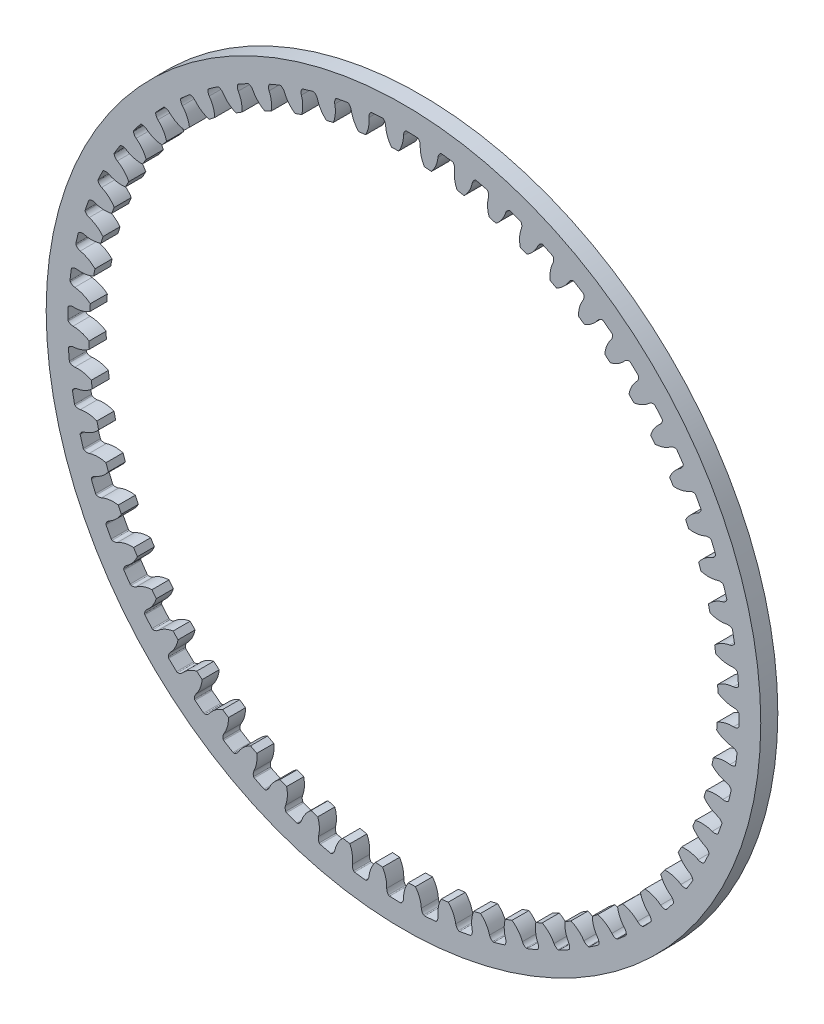
from build123d import *

# Parameters (mm, degrees)
BOSS_EXTRUDE1_DEPTH = 3.5
CHAMFER1_SIZE       = 0.5
FILLET2_R           = 1.4
FILLET3_R           = 0.3
CIRPATTERN1_DEPTH   = 3.5


# Read off the part's stored shape, not the designer's step: CirPattern1
with BuildPart() as part:
    # Sketch1 → Boss-Extrude1 (new body)
    with BuildSketch(Plane.XY):
        with BuildLine():
            Line((-7.093200614, 67.487306793), (-7.203054967, 68.532503961))
            ThreePointArc((-7.203054967, 68.532503961), (-5.465102965, 68.692945414), (-3.7236451, 68.809320351))
            Line((-3.7236451, 68.809320351), (-3.669087823, 67.801148418))
            ThreePointArc((-3.669087823, 67.801148418), (-3.311888955, 66.061957245), (-2.461340021, 64.503450435))
            Line((-2.461340021, 64.503450435), (-0.999634675, 64.542971937))
            ThreePointArc((-0.999634675, 64.542971937), (-0.255341962, 66.127311516), (0, 67.859045914))
            Line((0, 67.859045914), (0, 68.91))
            ThreePointArc((0, 68.91), (0.866615162, 68.90455049), (1.733093257, 68.88820282))
            Line((1.733093257, 68.88820282), (1.844759693, 73.326798387))
            ThreePointArc((1.844759693, 73.326798387), (-5.830083646, 73.117936409), (-13.441051368, 72.107979018))
            Line((-13.441051368, 72.107979018), (-12.627441714, 67.743160657))
            ThreePointArc((-12.627441714, 67.743160657), (-11.762567505, 67.898675287), (-10.895780524, 68.043148566))
            Line((-10.895780524, 68.043148566), (-10.736139102, 67.046202549))
            ThreePointArc((-10.736139102, 67.046202549), (-10.199101212, 65.353876174), (-9.190302449, 63.892813782))
            Line((-9.190302449, 63.892813782), (-7.740736018, 64.084908534))
            ThreePointArc((-7.740736018, 64.084908534), (-7.166128741, 65.738368542), (-7.093200614, 67.487306793))
        make_face()
    extrude(amount=BOSS_EXTRUDE1_DEPTH)

    # Chamfer1
    chamfer1_edges = [part.edges().sort_by_distance(p)[0] for p in [
        (-3.7236451, 68.809320351, 1.75),
        (-7.203054967, 68.532503961, 1.75),
        (-10.895780524, 68.043148566, 1.75),
        (0, 68.91, 1.75),
    ]]
    chamfer(chamfer1_edges, length=CHAMFER1_SIZE - 0.0004)  # a hair under: the kernel refuses the full size

    # Fillet2
    fillet2_edges = [part.edges().sort_by_distance(p)[0] for p in [
        (0, 68.4104, 1.75),
        (-3.696648719, 68.310450272, 1.75),
        (-7.150832686, 68.035640807, 1.75),
        (-10.81678572, 67.54983327, 1.75),
    ]]
    fillet(fillet2_edges, radius=FILLET2_R)

    # Fillet3
    fillet3_edges = [part.edges().sort_by_distance(p)[0] for p in [
        (-11.38880622, 67.962366004, 1.75),
        (0.499596717, 68.908188941, 1.75),
        (-4.222414028, 68.780515553, 1.75),
        (-6.706005784, 68.58292489, 1.75),
    ]]
    fillet(fillet3_edges, radius=FILLET3_R)

    # CirPattern1 outline → CirPattern1 (add)
    with BuildSketch(Plane.XY):
        with BuildLine():
            Line((1.844759693, 73.326798387), (1.733093257, 68.88820282))
            ThreePointArc((1.733093257, 68.88820282), (2.299511856, 68.871622205), (2.86577496, 68.850384413))
            ThreePointArc((2.86577496, 68.850384413), (2.980831386, 68.822186651), (3.076002513, 68.751649061))
            ThreePointArc((3.076002513, 68.751649061), (3.353485369, 68.289151249), (3.435535192, 67.756076407))
            ThreePointArc((3.435535192, 67.756076407), (3.618653485, 66.018512763), (4.294590654, 64.407373827))
            Line((4.294590654, 64.407373827), (5.752419325, 64.29388904))
            ThreePointArc((5.752419325, 64.29388904), (6.65368157, 65.780913241), (7.090699115, 67.463925503))
            ThreePointArc((7.090699115, 67.463925503), (7.25312204, 67.982028039), (7.600452429, 68.399368483))
            ThreePointArc((7.600452429, 68.399368483), (7.705424882, 68.454381137), (7.823510636, 68.464449033))
            ThreePointArc((7.823510636, 68.464449033), (8.936389306, 68.328098511), (10.046902252, 68.17365954))
            ThreePointArc((10.046902252, 68.17365954), (10.158380982, 68.133589535), (10.245657588, 68.05349018))
            ThreePointArc((10.245657588, 68.05349018), (10.4732759, 67.564521093), (10.499154515, 67.025790028))
            ThreePointArc((10.499154515, 67.025790028), (10.499644069, 65.278604195), (11.003467608, 63.605636647))
            Line((11.003467608, 63.605636647), (12.441448167, 63.34038888))
            ThreePointArc((12.441448167, 63.34038888), (13.493209118, 64.725059646), (14.103754874, 66.353171468))
            ThreePointArc((14.103754874, 66.353171468), (14.319444274, 66.851457878), (14.708495626, 67.230206223))
            ThreePointArc((14.708495626, 67.230206223), (14.818643464, 67.273944969), (14.937134782, 67.271614404))
            ThreePointArc((14.937134782, 67.271614404), (16.029664521, 67.019683343), (17.117950738, 66.750010206))
            ThreePointArc((17.117950738, 66.750010206), (17.224630261, 66.698507056), (17.30305608, 66.609723692))
            ThreePointArc((17.30305608, 66.609723692), (17.478316569, 66.099640638), (17.447740914, 65.561155642))
            ThreePointArc((17.447740914, 65.561155642), (17.265597838, 63.823489498), (17.591789537, 62.107022574))
            Line((17.591789537, 62.107022574), (18.994166341, 61.692918078))
            ThreePointArc((18.994166341, 61.692918078), (20.184903559, 62.960064275), (20.962289148, 64.515437624))
            ThreePointArc((20.962289148, 64.515437624), (21.228882316, 64.988448752), (21.65539266, 65.324455258))
            ThreePointArc((21.65539266, 65.324455258), (21.769508987, 65.356440753), (21.887107517, 65.341737232))
            ThreePointArc((21.887107517, 65.341737232), (22.947318251, 64.976985811), (24.001454157, 64.595033078))
            ThreePointArc((24.001454157, 64.595033078), (24.102165787, 64.532660967), (24.170881597, 64.436166149))
            ThreePointArc((24.170881597, 64.436166149), (24.291863513, 63.910557702), (24.205168131, 63.378218736))
            ThreePointArc((24.205168131, 63.378218736), (23.842386627, 61.669111322), (23.987370901, 59.927951325))
            Line((23.987370901, 59.927951325), (25.338780023, 59.369526888))
            ThreePointArc((25.338780023, 59.369526888), (26.655446714, 60.505265877), (27.591154063, 61.97085995))
            ThreePointArc((27.591154063, 61.97085995), (27.905729702, 62.413413258), (28.365025556, 62.702996719))
            ThreePointArc((28.365025556, 62.702996719), (28.481860196, 62.722878645), (28.597277643, 62.695963278))
            ThreePointArc((28.597277643, 62.695963278), (29.613553574, 62.22238781), (30.621989928, 61.732340251))
            ThreePointArc((30.621989928, 61.732340251), (30.71563014, 61.659782649), (30.773883068, 61.556633769))
            ThreePointArc((30.773883068, 61.556633769), (30.839261464, 61.021258549), (30.697396635, 60.500897778))
            ThreePointArc((30.697396635, 60.500897778), (30.157952716, 58.839073484), (30.120142804, 57.092296412))
            Line((30.120142804, 57.092296412), (31.405777144, 56.395670561))
            ThreePointArc((31.405777144, 56.395670561), (32.833948405, 57.387558385), (33.917726556, 58.747315543))
            ThreePointArc((33.917726556, 58.747315543), (34.276838568, 59.154562406), (34.763888318, 59.394549876))
            ThreePointArc((34.763888318, 59.394549876), (34.882161088, 59.402110294), (34.994132774, 59.36327797))
            ThreePointArc((34.994132774, 59.36327797), (35.955339275, 58.786067037), (36.907027344, 58.193293709))
            ThreePointArc((36.907027344, 58.193293709), (36.992570292, 58.111345453), (37.039722096, 58.002672457))
            ThreePointArc((37.039722096, 58.002672457), (37.048780125, 57.463396261), (36.853299751, 56.960715162))
            ThreePointArc((36.853299751, 56.960715162), (36.143102481, 55.364382361), (35.922910982, 53.631126963))
            Line((35.922910982, 53.631126963), (37.128685603, 52.803931684))
            ThreePointArc((37.128685603, 52.803931684), (38.652713382, 53.641101654), (39.872687422, 54.880124483))
            ThreePointArc((39.872687422, 54.880124483), (40.272400835, 55.247602986), (40.78186776, 55.435365376))
            ThreePointArc((40.78186776, 55.435365376), (40.900282967, 55.430521547), (41.007582247, 55.380197709))
            ThreePointArc((41.007582247, 55.380197709), (41.903188234, 54.705675353), (42.787701218, 54.016670802))
            ThreePointArc((42.787701218, 54.016670802), (42.864209593, 53.926229863), (42.899743696, 53.813223569))
            ThreePointArc((42.899743696, 53.813223569), (42.85238265, 53.275954649), (42.60542882, 52.796460366))
            ThreePointArc((42.60542882, 52.796460366), (41.732260347, 51.283107617), (41.332101297, 49.582362938))
            Line((41.332101297, 49.582362938), (42.444804783, 48.633661623))
            ThreePointArc((42.444804783, 48.633661623), (44.047992151, 49.306940817), (45.390796558, 50.411653871))
            ThreePointArc((45.390796558, 50.411653871), (45.826732496, 50.735337827), (46.353035241, 50.868817659))
            ThreePointArc((46.353035241, 50.868817659), (46.470295365, 50.851622571), (46.571746508, 50.790358605))
            ThreePointArc((46.571746508, 50.790358605), (47.391939439, 50.025915046), (48.199586335, 49.248228162))
            ThreePointArc((48.199586335, 49.248228162), (48.266221965, 49.150285293), (48.289749003, 49.034183652))
            ThreePointArc((48.289749003, 49.034183652), (48.186487266, 48.504808664), (47.890765331, 48.053755008))
            ThreePointArc((47.890765331, 48.053755008), (46.864191322, 46.639964225), (46.288447476, 44.990365002))
            Line((46.288447476, 44.990365002), (47.29588946, 43.930551285))
            ThreePointArc((47.29588946, 43.930551285), (48.960670999, 44.432563889), (50.41159301, 45.390864231))
            ThreePointArc((50.41159301, 45.390864231), (50.878974803, 45.667207356), (51.416346649, 45.744942558))
            ThreePointArc((51.416346649, 45.744942558), (51.531167112, 45.715584672), (51.62565873, 45.644051756))
            ThreePointArc((51.62565873, 45.644051756), (52.361452494, 44.798062377), (53.083384646, 43.940213638))
            ThreePointArc((53.083384646, 43.940213638), (53.139417401, 43.835842065), (53.150679669, 43.717917274))
            ThreePointArc((53.150679669, 43.717917274), (52.992649086, 43.202235884), (52.651399323, 42.78456429))
            ThreePointArc((52.651399323, 42.78456429), (51.482667946, 41.485823863), (50.73764863, 39.905442281))
            Line((50.73764863, 39.905442281), (51.628790781, 38.746128303))
            ThreePointArc((51.628790781, 38.746128303), (53.336927274, 39.071373335), (54.880070942, 39.872761023))
            ThreePointArc((54.880070942, 39.872761023), (55.373778312, 40.098735531), (55.916332097, 40.119874014))
            ThreePointArc((55.916332097, 40.119874014), (56.027454747, 40.078674929), (56.113951443, 39.997656849))
            ThreePointArc((56.113951443, 39.997656849), (56.757284438, 39.079390517), (57.385592117, 38.150778725))
            ThreePointArc((57.385592117, 38.150778725), (57.430408131, 38.041121817), (57.429282158, 37.922665729))
            ThreePointArc((57.429282158, 37.922665729), (57.21821369, 37.426328177), (56.835174659, 37.046615173))
            ThreePointArc((56.835174659, 37.046615173), (55.537090124, 35.877155848), (54.630956698, 34.383308203))
            Line((54.630956698, 34.383308203), (55.396035996, 33.137194992))
            ThreePointArc((55.396035996, 33.137194992), (57.128812354, 33.282109872), (58.747270082, 33.917805404))
            ThreePointArc((58.747270082, 33.917805404), (59.261893428, 34.090935629), (59.803684467, 34.055246241))
            ThreePointArc((59.803684467, 34.055246241), (59.909891979, 34.002657379), (59.987446199, 33.913041717))
            ThreePointArc((59.987446199, 33.913041717), (60.531270022, 32.932559111), (61.059069442, 31.94335829))
            ThreePointArc((61.059069442, 31.94335829), (61.092177677, 31.829617621), (61.078675895, 31.711928212))
            ThreePointArc((61.078675895, 31.711928212), (60.81688247, 31.240372104), (60.396251025, 30.902777452))
            ThreePointArc((60.396251025, 30.902777452), (58.983035915, 29.875410536), (57.925717252, 28.484462308))
            Line((57.925717252, 28.484462308), (58.556350879, 27.165203251))
            ThreePointArc((58.556350879, 27.165203251), (60.294782736, 27.128199352), (61.970822882, 27.591237187))
            ThreePointArc((61.970822882, 27.591237187), (62.500724303, 27.709626076), (63.035816924, 27.617499358))
            ThreePointArc((63.035816924, 27.617499358), (63.135945506, 27.554096874), (63.203707436, 27.456865559))
            ThreePointArc((63.203707436, 27.456865559), (63.642063756, 26.424909099), (64.063572157, 25.385957191))
            ThreePointArc((64.063572157, 25.385957191), (64.08460988, 25.269378776), (64.058880107, 25.15374534))
            ThreePointArc((64.058880107, 25.15374534), (63.749229611, 24.712137557), (63.29561413, 24.420360486))
            ThreePointArc((63.29561413, 24.420360486), (61.782751591, 23.546343603), (60.585830964, 22.273535846))
            Line((60.585830964, 22.273535846), (61.075109939, 20.895584268))
            ThreePointArc((61.075109939, 20.895584268), (62.800150473, 20.677067948), (64.51540955, 20.962375724))
            ThreePointArc((64.51540955, 20.962375724), (65.054782939, 21.024726429), (65.577314304, 20.877172249))
            ThreePointArc((65.577314304, 20.877172249), (65.670267088, 20.803650796), (65.727494418, 20.699869021))
            ThreePointArc((65.727494418, 20.699869021), (66.055580589, 19.627744982), (66.366179911, 18.550424903))
            ThreePointArc((66.366179911, 18.550424903), (66.374916636, 18.432286151), (66.337240896, 18.319975717))
            ThreePointArc((66.337240896, 18.319975717), (65.983126258, 17.913154155), (65.501496745, 17.670390951))
            ThreePointArc((65.501496745, 17.670390951), (63.905562183, 16.95929841), (62.582154071, 15.818574649))
            Line((62.582154071, 15.818574649), (62.92471746, 14.397028464))
            ThreePointArc((62.92471746, 14.397028464), (64.617466866, 13.999392883), (66.353152493, 14.103843889))
            ThreePointArc((66.353152493, 14.103843889), (66.896088731, 14.109472996), (67.400334072, 13.908107456))
            ThreePointArc((67.400334072, 13.908107456), (67.485092487, 13.825272566), (67.531158129, 13.716077491))
            ThreePointArc((67.531158129, 13.716077491), (67.745379499, 12.615532352), (67.941666682, 11.511647511))
            ThreePointArc((67.941666682, 11.511647511), (67.938006665, 11.393242626), (67.888797606, 11.285485579))
            ThreePointArc((67.888797606, 11.285485579), (67.494098296, 10.917907943), (66.989731537, 10.726818863))
            ThreePointArc((66.989731537, 10.726818863), (65.328210346, 10.186443155), (63.892813694, 9.190303092))
            Line((63.892813694, 9.190303092), (64.084908507, 7.740736243))
            ThreePointArc((64.084908507, 7.740736243), (65.726820669, 7.168338935), (67.463916042, 7.090789637))
            ThreePointArc((67.463916042, 7.090789637), (68.004466269, 7.039635796), (68.484900831, 6.786665649))
            ThreePointArc((68.484900831, 6.786665649), (68.560536403, 6.695424846), (68.594935735, 6.582012721))
            ThreePointArc((68.594935735, 6.582012721), (68.692945314, 5.465104214), (68.772769856, 4.346748933))
            ThreePointArc((68.772769856, 4.346748933), (68.756753236, 4.229375329), (68.696550149, 4.127352374))
            ThreePointArc((68.696550149, 4.127352374), (68.265590806, 3.803045412), (67.744012745, 3.665723573))
            ThreePointArc((67.744012745, 3.665723573), (66.03510873, 3.301983564), (64.503450455, 2.461339372))
            Line((64.503450455, 2.461339372), (64.542971941, 0.999634448))
            ThreePointArc((64.542971941, 0.999634448), (66.116057625, 0.258745767), (67.835530942, 4.4935e-05))
            ThreePointArc((67.835530942, 4.4935e-05), (68.367773077, -0.107331758), (68.819133198, -0.40913548))
            ThreePointArc((68.819133198, -0.40913548), (68.884817096, -0.507782494), (68.907173161, -0.62416898))
            ThreePointArc((68.907173161, -0.62416898), (68.88789708, -1.745203695), (68.850384353, -2.865776403))
            ThreePointArc((68.850384353, -2.865776403), (68.822186556, -2.980832897), (68.751648884, -3.076004056))
            ThreePointArc((68.751648884, -3.076004056), (68.289151013, -3.353486637), (67.756076224, -3.435536217))
            ThreePointArc((67.756076224, -3.435536217), (66.01851283, -3.618653739), (64.407373874, -4.294590007))
            Line((64.407373874, -4.294590007), (64.29388906, -5.752419099))
            ThreePointArc((64.29388906, -5.752419099), (65.78091341, -6.653680887), (67.463925676, -7.090697983))
            ThreePointArc((67.463925676, -7.090697983), (67.982028102, -7.253120701), (68.399368564, -7.600450806))
            ThreePointArc((68.399368564, -7.600450806), (68.454381288, -7.705423298), (68.464449206, -7.823509119))
            ThreePointArc((68.464449206, -7.823509119), (68.328098704, -8.936387833), (68.173659751, -10.046900823))
            ThreePointArc((68.173659751, -10.046900823), (68.133589788, -10.158379489), (68.053490518, -10.245656072))
            ThreePointArc((68.053490518, -10.245656072), (67.564521462, -10.473274664), (67.025790317, -10.499153514))
            ThreePointArc((67.025790317, -10.499153514), (65.278604154, -10.499643809), (63.605636532, -11.003468246))
            Line((63.605636532, -11.003468246), (63.340388836, -12.441448389))
            ThreePointArc((63.340388836, -12.441448389), (64.725059405, -13.49320978), (66.353171178, -14.103755982))
            ThreePointArc((66.353171178, -14.103755982), (66.851457676, -14.3194456), (67.230205973, -14.708497232))
            ThreePointArc((67.230205973, -14.708497232), (67.273944653, -14.818645022), (67.271614073, -14.937136272))
            ThreePointArc((67.271614073, -14.937136272), (67.019682997, -16.029665966), (66.750009847, -17.117952137))
            ThreePointArc((66.750009847, -17.117952137), (66.69850665, -17.22463172), (66.609723198, -17.303057553))
            ThreePointArc((66.609723198, -17.303057553), (66.099640142, -17.47831776), (65.56115525, -17.447741879))
            ThreePointArc((65.56115525, -17.447741879), (63.823489512, -17.265598101), (62.107022755, -17.591788915))
            Line((62.107022755, -17.591788915), (61.692918145, -18.994166124))
            ThreePointArc((61.692918145, -18.994166124), (62.960064583, -20.184902926), (64.515438029, -20.962288076))
            ThreePointArc((64.515438029, -20.962288076), (64.988449092, -21.22888102), (65.324455675, -21.655391089))
            ThreePointArc((65.324455675, -21.655391089), (65.356441231, -21.769507469), (65.341737717, -21.887106069))
            ThreePointArc((65.341737717, -21.887106069), (64.976986306, -22.94731685), (64.595033581, -24.001452803))
            ThreePointArc((64.595033581, -24.001452803), (64.532661524, -24.102164379), (64.436166794, -24.170880185))
            ThreePointArc((64.436166794, -24.170880185), (63.910558319, -24.29186238), (63.378219227, -24.205167213))
            ThreePointArc((63.378219227, -24.205167213), (61.669111336, -23.842386364), (59.927951079, -23.987371501))
            Line((59.927951079, -23.987371501), (59.369526799, -25.338780232))
            ThreePointArc((59.369526799, -25.338780232), (60.505265506, -26.655447312), (61.970859436, -27.591155086))
            ThreePointArc((61.970859436, -27.591155086), (62.413412785, -27.905730956), (62.702996141, -28.365027075))
            ThreePointArc((62.702996141, -28.365027075), (62.722878012, -28.481861655), (62.695962645, -28.597279032))
            ThreePointArc((62.695962645, -28.597279032), (62.222387171, -29.613554915), (61.732339609, -30.621991222))
            ThreePointArc((61.732339609, -30.621991222), (61.659781947, -30.715631482), (61.556632979, -30.773884405))
            ThreePointArc((61.556632979, -30.773884405), (61.021257816, -30.839262526), (60.500897194, -30.697397497))
            ThreePointArc((60.500897194, -30.697397497), (58.839073442, -30.157952975), (57.092296719, -30.120142232))
            Line((57.092296719, -30.120142232), (56.395670671, -31.405776945))
            ThreePointArc((56.395670671, -31.405776945), (57.387558817, -32.83394785), (58.747316161, -33.917725592))
            ThreePointArc((58.747316161, -33.917725592), (59.154563008, -34.27683737), (59.394550611, -34.763886868))
            ThreePointArc((59.394550611, -34.763886868), (59.402111076, -34.882159703), (59.363278746, -34.994131459))
            ThreePointArc((59.363278746, -34.994131459), (58.786067812, -35.955338007), (58.193294482, -36.907026124))
            ThreePointArc((58.193294482, -36.907026124), (58.11134629, -36.99256903), (58.002673382, -37.039720848))
            ThreePointArc((58.002673382, -37.039720848), (57.4633971, -37.048779146), (56.960715834, -36.853298955))
            ThreePointArc((56.960715834, -36.853298955), (55.36438243, -36.143102227), (53.631126598, -35.922911518))
            Line((53.631126598, -35.922911518), (52.803931554, -37.128685789))
            ThreePointArc((52.803931554, -37.128685789), (53.641101166, -38.652713889), (54.880123767, -39.872688316))
            ThreePointArc((54.880123767, -39.872688316), (55.247602263, -40.272401964), (55.435364495, -40.781869126))
            ThreePointArc((55.435364495, -40.781869126), (55.430520624, -40.900284263), (55.3801968, -41.007583474))
            ThreePointArc((55.3801968, -41.007583474), (54.70567445, -41.903189413), (54.016669905, -42.78770235))
            ThreePointArc((54.016669905, -42.78770235), (53.926228897, -42.86421076), (53.813222518, -42.89974484))
            ThreePointArc((53.813222518, -42.89974484), (53.275953711, -42.852383537), (52.796459615, -42.605429542))
            ThreePointArc((52.796459615, -42.605429542), (51.283107522, -41.732260592), (49.582363357, -41.332100802))
            Line((49.582363357, -41.332100802), (48.633661772, -42.444804612))
            ThreePointArc((48.633661772, -42.444804612), (49.306941355, -44.047991698), (50.411654676, -45.390795744))
            ThreePointArc((50.411654676, -45.390795744), (50.735338665, -45.826731449), (50.868818678, -46.353033975))
            ThreePointArc((50.868818678, -46.353033975), (50.851623624, -46.470294173), (50.790359637, -46.571745383))
            ThreePointArc((50.790359637, -46.571745383), (50.025916068, -47.391938361), (49.248229172, -48.199585303))
            ThreePointArc((49.248229172, -48.199585303), (49.150286375, -48.266220905), (49.034184816, -48.289747975))
            ThreePointArc((49.034184816, -48.289747975), (48.504809689, -48.186486483), (48.053755831, -47.890764691))
            ThreePointArc((48.053755831, -47.890764691), (46.639964345, -46.864191089), (44.990364534, -46.288447924))
            Line((44.990364534, -46.288447924), (43.930551119, -47.295889614))
            ThreePointArc((43.930551119, -47.295889614), (44.432563307, -48.960671393), (45.390863345, -50.411593735))
            ThreePointArc((45.390863345, -50.411593735), (45.667206414, -50.878975756), (45.744941412, -51.416347802))
            ThreePointArc((45.744941412, -51.416347802), (45.7155835, -51.531168187), (45.644050612, -51.625659741))
            ThreePointArc((45.644050612, -51.625659741), (44.798061248, -52.36145346), (43.940212525, -53.083385567))
            ThreePointArc((43.940212525, -53.083385567), (43.835840878, -53.139418341), (43.717916009, -53.15068057))
            ThreePointArc((43.717916009, -53.15068057), (43.202234783, -52.992649758), (42.784563406, -52.651399872))
            ThreePointArc((42.784563406, -52.651399872), (41.48582372, -51.482668166), (39.905442793, -50.737648233))
            Line((39.905442793, -50.737648233), (38.746128484, -51.628790645))
            ThreePointArc((38.746128484, -51.628790645), (39.071373955, -53.336926943), (39.87276198, -54.880070313))
            ThreePointArc((39.87276198, -54.880070313), (40.098736567, -55.373777462), (40.119875274, -55.916331071))
            ThreePointArc((40.119875274, -55.916331071), (40.078676207, -56.0274538), (39.997658092, -56.113950557))
            ThreePointArc((39.997658092, -56.113950557), (39.079391741, -56.757283596), (38.150779928, -57.385591318))
            ThreePointArc((38.150779928, -57.385591318), (38.041123095, -57.430407319), (37.922667081, -57.429281394))
            ThreePointArc((37.922667081, -57.429281394), (37.426329342, -57.218213136), (37.046616111, -56.835174205))
            ThreePointArc((37.046616111, -56.835174205), (35.877156014, -55.53708992), (34.383307651, -54.63095704))
            Line((34.383307651, -54.63095704), (33.137194797, -55.396036112))
            ThreePointArc((33.137194797, -55.396036112), (33.28210922, -57.128812618), (33.917804386, -58.747270607))
            ThreePointArc((33.917804386, -58.747270607), (34.09093451, -59.261894164), (34.05524488, -59.803685356))
            ThreePointArc((34.05524488, -59.803685356), (34.002656009, -59.909892788), (33.913040387, -59.987446951))
            ThreePointArc((33.913040387, -59.987446951), (32.932557805, -60.531270732), (31.94335701, -61.059070112))
            ThreePointArc((31.94335701, -61.059070112), (31.829616265, -61.09217835), (31.711926788, -61.078676513))
            ThreePointArc((31.711926788, -61.078676513), (31.240370887, -60.816882898), (30.902776472, -60.396251379))
            ThreePointArc((30.902776472, -60.396251379), (29.875410349, -58.9830361), (28.484462892, -57.92571697))
            Line((28.484462892, -57.92571697), (27.165203457, -58.556350784))
            ThreePointArc((27.165203457, -58.556350784), (27.128200028, -60.294782541), (27.591238254, -61.970822466))
            ThreePointArc((27.591238254, -61.970822466), (27.709627267, -62.500723687), (27.617500804, -63.035816182))
            ThreePointArc((27.617500804, -63.035816182), (27.554098321, -63.135944845), (27.456866959, -63.203706828))
            ThreePointArc((27.456866959, -63.203706828), (26.42491047, -63.642063186), (25.385958533, -64.063571625))
            ThreePointArc((25.385958533, -64.063571625), (25.269380195, -64.084609352), (25.153746822, -64.058879641))
            ThreePointArc((25.153746822, -64.058879641), (24.712138811, -63.749229312), (24.420361497, -63.295613881))
            ThreePointArc((24.420361497, -63.295613881), (23.546343808, -61.782751426), (22.273535235, -60.585831184))
            Line((22.273535235, -60.585831184), (20.895584053, -61.075110013))
            ThreePointArc((20.895584053, -61.075110013), (20.677067255, -62.800150597), (20.96237462, -64.515409853))
            ThreePointArc((20.96237462, -64.515409853), (21.02472518, -65.054783427), (20.877170733, -65.57731489))
            ThreePointArc((20.877170733, -65.57731489), (20.803649288, -65.670267593), (20.699867565, -65.727494877))
            ThreePointArc((20.699867565, -65.727494877), (19.627743558, -66.055581012), (18.550423512, -66.366180299))
            ThreePointArc((18.550423512, -66.366180299), (18.432284685, -66.374917013), (18.319974195, -66.337241205))
            ThreePointArc((18.319974195, -66.337241205), (17.913152876, -65.983126424), (17.670389919, -65.501496887))
            ThreePointArc((17.670389919, -65.501496887), (16.959298189, -63.905562326), (15.818575279, -62.582153917))
            Line((15.818575279, -62.582153917), (14.397028685, -62.924717409))
            ThreePointArc((14.397028685, -62.924717409), (13.999393584, -64.617466816), (14.103845019, -66.353152307))
            ThreePointArc((14.103845019, -66.353152307), (14.109474289, -66.896088376), (13.908109025, -67.400333647))
            ThreePointArc((13.908109025, -67.400333647), (13.825274119, -67.485092141), (13.716078987, -67.531157825))
            ThreePointArc((13.716078987, -67.531157825), (12.615533812, -67.745379227), (11.511648935, -67.941666441))
            ThreePointArc((11.511648935, -67.941666441), (11.393244124, -67.938006444), (11.285487125, -67.888797459))
            ThreePointArc((11.285487125, -67.888797459), (10.917909233, -67.494098264), (10.726819904, -66.989731503))
            ThreePointArc((10.726819904, -66.989731503), (10.186443389, -65.328210227), (9.190302449, -63.892813782))
            Line((9.190302449, -63.892813782), (7.740736018, -64.084908534))
            ThreePointArc((7.740736018, -64.084908534), (7.168338232, -65.726820646), (7.090788493, -67.463916109))
            ThreePointArc((7.090788493, -67.463916109), (7.039634473, -68.004466487), (6.786664044, -68.484901089))
            ThreePointArc((6.786664044, -68.484901089), (6.695423265, -68.560536585), (6.582011201, -68.594935881))
            ThreePointArc((6.582011201, -68.594935881), (5.465102733, -68.692945432), (4.346747492, -68.772769947))
            ThreePointArc((4.346747492, -68.772769947), (4.229373817, -68.756753299), (4.127350821, -68.696550134))
            ThreePointArc((4.127350821, -68.696550134), (3.803044127, -68.265590702), (3.665722535, -67.74401267))
            ThreePointArc((3.665722535, -67.74401267), (3.301983318, -66.035108824), (2.461340021, -64.503450435))
            Line((2.461340021, -64.503450435), (0.999634675, -64.542971937))
            ThreePointArc((0.999634675, -64.542971937), (0.258746464, -66.116057722), (4.6079e-05, -67.835530996))
            ThreePointArc((4.6079e-05, -67.835530996), (-0.10733042, -68.367773), (-0.409133857, -68.819133109))
            ThreePointArc((-0.409133857, -68.819133109), (-0.507780904, -68.884817081), (-0.624167454, -68.907173175))
            ThreePointArc((-0.624167454, -68.907173175), (-1.74520221, -68.887897117), (-2.86577496, -68.850384413))
            ThreePointArc((-2.86577496, -68.850384413), (-2.980831386, -68.822186651), (-3.076002513, -68.751649061))
            ThreePointArc((-3.076002513, -68.751649061), (-3.353485369, -68.289151249), (-3.435535192, -67.756076407))
            ThreePointArc((-3.435535192, -67.756076407), (-3.618653485, -66.018512763), (-4.294590654, -64.407373827))
            Line((-4.294590654, -64.407373827), (-5.752419325, -64.29388904))
            ThreePointArc((-5.752419325, -64.29388904), (-6.65368157, -65.780913241), (-7.090699115, -67.463925503))
            ThreePointArc((-7.090699115, -67.463925503), (-7.25312204, -67.982028039), (-7.600452429, -68.399368483))
            ThreePointArc((-7.600452429, -68.399368483), (-7.705424882, -68.454381137), (-7.823510636, -68.464449033))
            ThreePointArc((-7.823510636, -68.464449033), (-8.936389306, -68.328098511), (-10.046902252, -68.17365954))
            ThreePointArc((-10.046902252, -68.17365954), (-10.158380982, -68.133589535), (-10.245657588, -68.05349018))
            ThreePointArc((-10.245657588, -68.05349018), (-10.4732759, -67.564521093), (-10.499154515, -67.025790028))
            ThreePointArc((-10.499154515, -67.025790028), (-10.499644069, -65.278604195), (-11.003467608, -63.605636647))
            Line((-11.003467608, -63.605636647), (-12.441448167, -63.34038888))
            ThreePointArc((-12.441448167, -63.34038888), (-13.493209118, -64.725059646), (-14.103754874, -66.353171468))
            ThreePointArc((-14.103754874, -66.353171468), (-14.319444274, -66.851457878), (-14.708495626, -67.230206223))
            ThreePointArc((-14.708495626, -67.230206223), (-14.818643464, -67.273944969), (-14.937134782, -67.271614404))
            ThreePointArc((-14.937134782, -67.271614404), (-16.029664521, -67.019683343), (-17.117950738, -66.750010206))
            ThreePointArc((-17.117950738, -66.750010206), (-17.224630261, -66.698507056), (-17.30305608, -66.609723692))
            ThreePointArc((-17.30305608, -66.609723692), (-17.478316569, -66.099640638), (-17.447740914, -65.561155642))
            ThreePointArc((-17.447740914, -65.561155642), (-17.265597838, -63.823489498), (-17.591789537, -62.107022574))
            Line((-17.591789537, -62.107022574), (-18.994166341, -61.692918078))
            ThreePointArc((-18.994166341, -61.692918078), (-20.184903559, -62.960064275), (-20.962289148, -64.515437624))
            ThreePointArc((-20.962289148, -64.515437624), (-21.228882316, -64.988448752), (-21.65539266, -65.324455258))
            ThreePointArc((-21.65539266, -65.324455258), (-21.769508987, -65.356440753), (-21.887107517, -65.341737232))
            ThreePointArc((-21.887107517, -65.341737232), (-22.947318251, -64.976985811), (-24.001454157, -64.595033078))
            ThreePointArc((-24.001454157, -64.595033078), (-24.102165787, -64.532660967), (-24.170881597, -64.436166149))
            ThreePointArc((-24.170881597, -64.436166149), (-24.291863513, -63.910557702), (-24.205168131, -63.378218736))
            ThreePointArc((-24.205168131, -63.378218736), (-23.842386627, -61.669111322), (-23.987370901, -59.927951325))
            Line((-23.987370901, -59.927951325), (-25.338780023, -59.369526888))
            ThreePointArc((-25.338780023, -59.369526888), (-26.655446714, -60.505265877), (-27.591154063, -61.97085995))
            ThreePointArc((-27.591154063, -61.97085995), (-27.905729702, -62.413413258), (-28.365025556, -62.702996719))
            ThreePointArc((-28.365025556, -62.702996719), (-28.481860196, -62.722878645), (-28.597277643, -62.695963278))
            ThreePointArc((-28.597277643, -62.695963278), (-29.613553574, -62.22238781), (-30.621989928, -61.732340251))
            ThreePointArc((-30.621989928, -61.732340251), (-30.71563014, -61.659782649), (-30.773883068, -61.556633769))
            ThreePointArc((-30.773883068, -61.556633769), (-30.839261464, -61.021258549), (-30.697396635, -60.500897778))
            ThreePointArc((-30.697396635, -60.500897778), (-30.157952716, -58.839073484), (-30.120142804, -57.092296412))
            Line((-30.120142804, -57.092296412), (-31.405777144, -56.395670561))
            ThreePointArc((-31.405777144, -56.395670561), (-32.833948405, -57.387558385), (-33.917726556, -58.747315543))
            ThreePointArc((-33.917726556, -58.747315543), (-34.276838568, -59.154562406), (-34.763888318, -59.394549876))
            ThreePointArc((-34.763888318, -59.394549876), (-34.882161088, -59.402110294), (-34.994132774, -59.36327797))
            ThreePointArc((-34.994132774, -59.36327797), (-35.955339275, -58.786067037), (-36.907027344, -58.193293709))
            ThreePointArc((-36.907027344, -58.193293709), (-36.992570292, -58.111345453), (-37.039722096, -58.002672457))
            ThreePointArc((-37.039722096, -58.002672457), (-37.048780125, -57.463396261), (-36.853299751, -56.960715162))
            ThreePointArc((-36.853299751, -56.960715162), (-36.143102481, -55.364382361), (-35.922910982, -53.631126963))
            Line((-35.922910982, -53.631126963), (-37.128685603, -52.803931684))
            ThreePointArc((-37.128685603, -52.803931684), (-38.652713382, -53.641101654), (-39.872687422, -54.880124483))
            ThreePointArc((-39.872687422, -54.880124483), (-40.272400835, -55.247602986), (-40.78186776, -55.435365376))
            ThreePointArc((-40.78186776, -55.435365376), (-40.900282967, -55.430521547), (-41.007582247, -55.380197709))
            ThreePointArc((-41.007582247, -55.380197709), (-41.903188234, -54.705675353), (-42.787701218, -54.016670802))
            ThreePointArc((-42.787701218, -54.016670802), (-42.864209593, -53.926229863), (-42.899743696, -53.813223569))
            ThreePointArc((-42.899743696, -53.813223569), (-42.85238265, -53.275954649), (-42.60542882, -52.796460366))
            ThreePointArc((-42.60542882, -52.796460366), (-41.732260347, -51.283107617), (-41.332101297, -49.582362938))
            Line((-41.332101297, -49.582362938), (-42.444804783, -48.633661623))
            ThreePointArc((-42.444804783, -48.633661623), (-44.047992151, -49.306940817), (-45.390796558, -50.411653871))
            ThreePointArc((-45.390796558, -50.411653871), (-45.826732496, -50.735337827), (-46.353035241, -50.868817659))
            ThreePointArc((-46.353035241, -50.868817659), (-46.470295365, -50.851622571), (-46.571746508, -50.790358605))
            ThreePointArc((-46.571746508, -50.790358605), (-47.391939439, -50.025915046), (-48.199586335, -49.248228162))
            ThreePointArc((-48.199586335, -49.248228162), (-48.266221965, -49.150285293), (-48.289749003, -49.034183652))
            ThreePointArc((-48.289749003, -49.034183652), (-48.186487266, -48.504808664), (-47.890765331, -48.053755008))
            ThreePointArc((-47.890765331, -48.053755008), (-46.864191322, -46.639964225), (-46.288447476, -44.990365002))
            Line((-46.288447476, -44.990365002), (-47.29588946, -43.930551285))
            ThreePointArc((-47.29588946, -43.930551285), (-48.960670999, -44.432563889), (-50.41159301, -45.390864231))
            ThreePointArc((-50.41159301, -45.390864231), (-50.878974803, -45.667207356), (-51.416346649, -45.744942558))
            ThreePointArc((-51.416346649, -45.744942558), (-51.531167112, -45.715584672), (-51.62565873, -45.644051756))
            ThreePointArc((-51.62565873, -45.644051756), (-52.361452494, -44.798062377), (-53.083384646, -43.940213638))
            ThreePointArc((-53.083384646, -43.940213638), (-53.139417401, -43.835842065), (-53.150679669, -43.717917274))
            ThreePointArc((-53.150679669, -43.717917274), (-52.992649086, -43.202235884), (-52.651399323, -42.78456429))
            ThreePointArc((-52.651399323, -42.78456429), (-51.482667946, -41.485823863), (-50.73764863, -39.905442281))
            Line((-50.73764863, -39.905442281), (-51.628790781, -38.746128303))
            ThreePointArc((-51.628790781, -38.746128303), (-53.336927274, -39.071373335), (-54.880070942, -39.872761023))
            ThreePointArc((-54.880070942, -39.872761023), (-55.373778312, -40.098735531), (-55.916332097, -40.119874014))
            ThreePointArc((-55.916332097, -40.119874014), (-56.027454747, -40.078674929), (-56.113951443, -39.997656849))
            ThreePointArc((-56.113951443, -39.997656849), (-56.757284438, -39.079390517), (-57.385592117, -38.150778725))
            ThreePointArc((-57.385592117, -38.150778725), (-57.430408131, -38.041121817), (-57.429282158, -37.922665729))
            ThreePointArc((-57.429282158, -37.922665729), (-57.21821369, -37.426328177), (-56.835174659, -37.046615173))
            ThreePointArc((-56.835174659, -37.046615173), (-55.537090124, -35.877155848), (-54.630956698, -34.383308203))
            Line((-54.630956698, -34.383308203), (-55.396035996, -33.137194992))
            ThreePointArc((-55.396035996, -33.137194992), (-57.128812354, -33.282109872), (-58.747270082, -33.917805404))
            ThreePointArc((-58.747270082, -33.917805404), (-59.261893428, -34.090935629), (-59.803684467, -34.055246241))
            ThreePointArc((-59.803684467, -34.055246241), (-59.909891979, -34.002657379), (-59.987446199, -33.913041717))
            ThreePointArc((-59.987446199, -33.913041717), (-60.531270022, -32.932559111), (-61.059069442, -31.94335829))
            ThreePointArc((-61.059069442, -31.94335829), (-61.092177677, -31.829617621), (-61.078675895, -31.711928212))
            ThreePointArc((-61.078675895, -31.711928212), (-60.81688247, -31.240372104), (-60.396251025, -30.902777452))
            ThreePointArc((-60.396251025, -30.902777452), (-58.983035915, -29.875410536), (-57.925717252, -28.484462308))
            Line((-57.925717252, -28.484462308), (-58.556350879, -27.165203251))
            ThreePointArc((-58.556350879, -27.165203251), (-60.294782736, -27.128199352), (-61.970822882, -27.591237187))
            ThreePointArc((-61.970822882, -27.591237187), (-62.500724303, -27.709626076), (-63.035816924, -27.617499358))
            ThreePointArc((-63.035816924, -27.617499358), (-63.135945506, -27.554096874), (-63.203707436, -27.456865559))
            ThreePointArc((-63.203707436, -27.456865559), (-63.642063756, -26.424909099), (-64.063572157, -25.385957191))
            ThreePointArc((-64.063572157, -25.385957191), (-64.08460988, -25.269378776), (-64.058880107, -25.15374534))
            ThreePointArc((-64.058880107, -25.15374534), (-63.749229611, -24.712137557), (-63.29561413, -24.420360486))
            ThreePointArc((-63.29561413, -24.420360486), (-61.782751591, -23.546343603), (-60.585830964, -22.273535846))
            Line((-60.585830964, -22.273535846), (-61.075109939, -20.895584268))
            ThreePointArc((-61.075109939, -20.895584268), (-62.800150473, -20.677067948), (-64.51540955, -20.962375724))
            ThreePointArc((-64.51540955, -20.962375724), (-65.054782939, -21.024726429), (-65.577314304, -20.877172249))
            ThreePointArc((-65.577314304, -20.877172249), (-65.670267088, -20.803650796), (-65.727494418, -20.699869021))
            ThreePointArc((-65.727494418, -20.699869021), (-66.055580589, -19.627744982), (-66.366179911, -18.550424903))
            ThreePointArc((-66.366179911, -18.550424903), (-66.374916636, -18.432286151), (-66.337240896, -18.319975717))
            ThreePointArc((-66.337240896, -18.319975717), (-65.983126258, -17.913154155), (-65.501496745, -17.670390951))
            ThreePointArc((-65.501496745, -17.670390951), (-63.905562183, -16.95929841), (-62.582154071, -15.818574649))
            Line((-62.582154071, -15.818574649), (-62.92471746, -14.397028464))
            ThreePointArc((-62.92471746, -14.397028464), (-64.617466866, -13.999392883), (-66.353152493, -14.103843889))
            ThreePointArc((-66.353152493, -14.103843889), (-66.896088731, -14.109472996), (-67.400334072, -13.908107456))
            ThreePointArc((-67.400334072, -13.908107456), (-67.485092487, -13.825272566), (-67.531158129, -13.716077491))
            ThreePointArc((-67.531158129, -13.716077491), (-67.745379499, -12.615532352), (-67.941666682, -11.511647511))
            ThreePointArc((-67.941666682, -11.511647511), (-67.938006665, -11.393242626), (-67.888797606, -11.285485579))
            ThreePointArc((-67.888797606, -11.285485579), (-67.494098296, -10.917907943), (-66.989731537, -10.726818863))
            ThreePointArc((-66.989731537, -10.726818863), (-65.328210346, -10.186443155), (-63.892813694, -9.190303092))
            Line((-63.892813694, -9.190303092), (-64.084908507, -7.740736243))
            ThreePointArc((-64.084908507, -7.740736243), (-65.726820669, -7.168338935), (-67.463916042, -7.090789637))
            ThreePointArc((-67.463916042, -7.090789637), (-68.004466269, -7.039635796), (-68.484900831, -6.786665649))
            ThreePointArc((-68.484900831, -6.786665649), (-68.560536403, -6.695424846), (-68.594935735, -6.582012721))
            ThreePointArc((-68.594935735, -6.582012721), (-68.692945314, -5.465104214), (-68.772769856, -4.346748933))
            ThreePointArc((-68.772769856, -4.346748933), (-68.756753236, -4.229375329), (-68.696550149, -4.127352374))
            ThreePointArc((-68.696550149, -4.127352374), (-68.265590806, -3.803045412), (-67.744012745, -3.665723573))
            ThreePointArc((-67.744012745, -3.665723573), (-66.03510873, -3.301983564), (-64.503450455, -2.461339372))
            Line((-64.503450455, -2.461339372), (-64.542971941, -0.999634448))
            ThreePointArc((-64.542971941, -0.999634448), (-66.116057625, -0.258745767), (-67.835530942, -4.4935e-05))
            ThreePointArc((-67.835530942, -4.4935e-05), (-68.367773077, 0.107331758), (-68.819133198, 0.40913548))
            ThreePointArc((-68.819133198, 0.40913548), (-68.884817096, 0.507782494), (-68.907173161, 0.62416898))
            ThreePointArc((-68.907173161, 0.62416898), (-68.88789708, 1.745203695), (-68.850384353, 2.865776403))
            ThreePointArc((-68.850384353, 2.865776403), (-68.822186556, 2.980832897), (-68.751648884, 3.076004056))
            ThreePointArc((-68.751648884, 3.076004056), (-68.289151013, 3.353486637), (-67.756076224, 3.435536217))
            ThreePointArc((-67.756076224, 3.435536217), (-66.01851283, 3.618653739), (-64.407373874, 4.294590007))
            Line((-64.407373874, 4.294590007), (-64.29388906, 5.752419099))
            ThreePointArc((-64.29388906, 5.752419099), (-65.78091341, 6.653680887), (-67.463925676, 7.090697983))
            ThreePointArc((-67.463925676, 7.090697983), (-67.982028102, 7.253120701), (-68.399368564, 7.600450806))
            ThreePointArc((-68.399368564, 7.600450806), (-68.454381288, 7.705423298), (-68.464449206, 7.823509119))
            ThreePointArc((-68.464449206, 7.823509119), (-68.328098704, 8.936387833), (-68.173659751, 10.046900823))
            ThreePointArc((-68.173659751, 10.046900823), (-68.133589788, 10.158379489), (-68.053490518, 10.245656072))
            ThreePointArc((-68.053490518, 10.245656072), (-67.564521462, 10.473274664), (-67.025790317, 10.499153514))
            ThreePointArc((-67.025790317, 10.499153514), (-65.278604154, 10.499643809), (-63.605636532, 11.003468246))
            Line((-63.605636532, 11.003468246), (-63.340388836, 12.441448389))
            ThreePointArc((-63.340388836, 12.441448389), (-64.725059405, 13.49320978), (-66.353171178, 14.103755982))
            ThreePointArc((-66.353171178, 14.103755982), (-66.851457676, 14.3194456), (-67.230205973, 14.708497232))
            ThreePointArc((-67.230205973, 14.708497232), (-67.273944653, 14.818645022), (-67.271614073, 14.937136272))
            ThreePointArc((-67.271614073, 14.937136272), (-67.019682997, 16.029665966), (-66.750009847, 17.117952137))
            ThreePointArc((-66.750009847, 17.117952137), (-66.69850665, 17.22463172), (-66.609723198, 17.303057553))
            ThreePointArc((-66.609723198, 17.303057553), (-66.099640142, 17.47831776), (-65.56115525, 17.447741879))
            ThreePointArc((-65.56115525, 17.447741879), (-63.823489512, 17.265598101), (-62.107022755, 17.591788915))
            Line((-62.107022755, 17.591788915), (-61.692918145, 18.994166124))
            ThreePointArc((-61.692918145, 18.994166124), (-62.960064583, 20.184902926), (-64.515438029, 20.962288076))
            ThreePointArc((-64.515438029, 20.962288076), (-64.988449092, 21.22888102), (-65.324455675, 21.655391089))
            ThreePointArc((-65.324455675, 21.655391089), (-65.356441231, 21.769507469), (-65.341737717, 21.887106069))
            ThreePointArc((-65.341737717, 21.887106069), (-64.976986306, 22.94731685), (-64.595033581, 24.001452803))
            ThreePointArc((-64.595033581, 24.001452803), (-64.532661524, 24.102164379), (-64.436166794, 24.170880185))
            ThreePointArc((-64.436166794, 24.170880185), (-63.910558319, 24.29186238), (-63.378219227, 24.205167213))
            ThreePointArc((-63.378219227, 24.205167213), (-61.669111336, 23.842386364), (-59.927951079, 23.987371501))
            Line((-59.927951079, 23.987371501), (-59.369526799, 25.338780232))
            ThreePointArc((-59.369526799, 25.338780232), (-60.505265506, 26.655447312), (-61.970859436, 27.591155086))
            ThreePointArc((-61.970859436, 27.591155086), (-62.413412785, 27.905730956), (-62.702996141, 28.365027075))
            ThreePointArc((-62.702996141, 28.365027075), (-62.722878012, 28.481861655), (-62.695962645, 28.597279032))
            ThreePointArc((-62.695962645, 28.597279032), (-62.222387171, 29.613554915), (-61.732339609, 30.621991222))
            ThreePointArc((-61.732339609, 30.621991222), (-61.659781947, 30.715631482), (-61.556632979, 30.773884405))
            ThreePointArc((-61.556632979, 30.773884405), (-61.021257816, 30.839262526), (-60.500897194, 30.697397497))
            ThreePointArc((-60.500897194, 30.697397497), (-58.839073442, 30.157952975), (-57.092296719, 30.120142232))
            Line((-57.092296719, 30.120142232), (-56.395670671, 31.405776945))
            ThreePointArc((-56.395670671, 31.405776945), (-57.387558817, 32.83394785), (-58.747316161, 33.917725592))
            ThreePointArc((-58.747316161, 33.917725592), (-59.154563008, 34.27683737), (-59.394550611, 34.763886868))
            ThreePointArc((-59.394550611, 34.763886868), (-59.402111076, 34.882159703), (-59.363278746, 34.994131459))
            ThreePointArc((-59.363278746, 34.994131459), (-58.786067812, 35.955338007), (-58.193294482, 36.907026124))
            ThreePointArc((-58.193294482, 36.907026124), (-58.11134629, 36.99256903), (-58.002673382, 37.039720848))
            ThreePointArc((-58.002673382, 37.039720848), (-57.4633971, 37.048779146), (-56.960715834, 36.853298955))
            ThreePointArc((-56.960715834, 36.853298955), (-55.36438243, 36.143102227), (-53.631126598, 35.922911518))
            Line((-53.631126598, 35.922911518), (-52.803931554, 37.128685789))
            ThreePointArc((-52.803931554, 37.128685789), (-53.641101166, 38.652713889), (-54.880123767, 39.872688316))
            ThreePointArc((-54.880123767, 39.872688316), (-55.247602263, 40.272401964), (-55.435364495, 40.781869126))
            ThreePointArc((-55.435364495, 40.781869126), (-55.430520624, 40.900284263), (-55.3801968, 41.007583474))
            ThreePointArc((-55.3801968, 41.007583474), (-54.70567445, 41.903189413), (-54.016669905, 42.78770235))
            ThreePointArc((-54.016669905, 42.78770235), (-53.926228897, 42.86421076), (-53.813222518, 42.89974484))
            ThreePointArc((-53.813222518, 42.89974484), (-53.275953711, 42.852383537), (-52.796459615, 42.605429542))
            ThreePointArc((-52.796459615, 42.605429542), (-51.283107522, 41.732260592), (-49.582363357, 41.332100802))
            Line((-49.582363357, 41.332100802), (-48.633661772, 42.444804612))
            ThreePointArc((-48.633661772, 42.444804612), (-49.306941355, 44.047991698), (-50.411654676, 45.390795744))
            ThreePointArc((-50.411654676, 45.390795744), (-50.735338665, 45.826731449), (-50.868818678, 46.353033975))
            ThreePointArc((-50.868818678, 46.353033975), (-50.851623624, 46.470294173), (-50.790359637, 46.571745383))
            ThreePointArc((-50.790359637, 46.571745383), (-50.025916068, 47.391938361), (-49.248229172, 48.199585303))
            ThreePointArc((-49.248229172, 48.199585303), (-49.150286375, 48.266220905), (-49.034184816, 48.289747975))
            ThreePointArc((-49.034184816, 48.289747975), (-48.504809689, 48.186486483), (-48.053755831, 47.890764691))
            ThreePointArc((-48.053755831, 47.890764691), (-46.639964345, 46.864191089), (-44.990364534, 46.288447924))
            Line((-44.990364534, 46.288447924), (-43.930551119, 47.295889614))
            ThreePointArc((-43.930551119, 47.295889614), (-44.432563307, 48.960671393), (-45.390863345, 50.411593735))
            ThreePointArc((-45.390863345, 50.411593735), (-45.667206414, 50.878975756), (-45.744941412, 51.416347802))
            ThreePointArc((-45.744941412, 51.416347802), (-45.7155835, 51.531168187), (-45.644050612, 51.625659741))
            ThreePointArc((-45.644050612, 51.625659741), (-44.798061248, 52.36145346), (-43.940212525, 53.083385567))
            ThreePointArc((-43.940212525, 53.083385567), (-43.835840878, 53.139418341), (-43.717916009, 53.15068057))
            ThreePointArc((-43.717916009, 53.15068057), (-43.202234783, 52.992649758), (-42.784563406, 52.651399872))
            ThreePointArc((-42.784563406, 52.651399872), (-41.48582372, 51.482668166), (-39.905442793, 50.737648233))
            Line((-39.905442793, 50.737648233), (-38.746128484, 51.628790645))
            ThreePointArc((-38.746128484, 51.628790645), (-39.071373955, 53.336926943), (-39.87276198, 54.880070313))
            ThreePointArc((-39.87276198, 54.880070313), (-40.098736567, 55.373777462), (-40.119875274, 55.916331071))
            ThreePointArc((-40.119875274, 55.916331071), (-40.078676207, 56.0274538), (-39.997658092, 56.113950557))
            ThreePointArc((-39.997658092, 56.113950557), (-39.079391741, 56.757283596), (-38.150779928, 57.385591318))
            ThreePointArc((-38.150779928, 57.385591318), (-38.041123095, 57.430407319), (-37.922667081, 57.429281394))
            ThreePointArc((-37.922667081, 57.429281394), (-37.426329342, 57.218213136), (-37.046616111, 56.835174205))
            ThreePointArc((-37.046616111, 56.835174205), (-35.877156014, 55.53708992), (-34.383307651, 54.63095704))
            Line((-34.383307651, 54.63095704), (-33.137194797, 55.396036112))
            ThreePointArc((-33.137194797, 55.396036112), (-33.28210922, 57.128812618), (-33.917804386, 58.747270607))
            ThreePointArc((-33.917804386, 58.747270607), (-34.09093451, 59.261894164), (-34.05524488, 59.803685356))
            ThreePointArc((-34.05524488, 59.803685356), (-34.002656009, 59.909892788), (-33.913040387, 59.987446951))
            ThreePointArc((-33.913040387, 59.987446951), (-32.932557805, 60.531270732), (-31.94335701, 61.059070112))
            ThreePointArc((-31.94335701, 61.059070112), (-31.829616265, 61.09217835), (-31.711926788, 61.078676513))
            ThreePointArc((-31.711926788, 61.078676513), (-31.240370887, 60.816882898), (-30.902776472, 60.396251379))
            ThreePointArc((-30.902776472, 60.396251379), (-29.875410349, 58.9830361), (-28.484462892, 57.92571697))
            Line((-28.484462892, 57.92571697), (-27.165203457, 58.556350784))
            ThreePointArc((-27.165203457, 58.556350784), (-27.128200028, 60.294782541), (-27.591238254, 61.970822466))
            ThreePointArc((-27.591238254, 61.970822466), (-27.709627267, 62.500723687), (-27.617500804, 63.035816182))
            ThreePointArc((-27.617500804, 63.035816182), (-27.554098321, 63.135944845), (-27.456866959, 63.203706828))
            ThreePointArc((-27.456866959, 63.203706828), (-26.42491047, 63.642063186), (-25.385958533, 64.063571625))
            ThreePointArc((-25.385958533, 64.063571625), (-25.269380195, 64.084609352), (-25.153746822, 64.058879641))
            ThreePointArc((-25.153746822, 64.058879641), (-24.712138811, 63.749229312), (-24.420361497, 63.295613881))
            ThreePointArc((-24.420361497, 63.295613881), (-23.546343808, 61.782751426), (-22.273535235, 60.585831184))
            Line((-22.273535235, 60.585831184), (-20.895584053, 61.075110013))
            ThreePointArc((-20.895584053, 61.075110013), (-20.677067255, 62.800150597), (-20.96237462, 64.515409853))
            ThreePointArc((-20.96237462, 64.515409853), (-21.02472518, 65.054783427), (-20.877170733, 65.57731489))
            ThreePointArc((-20.877170733, 65.57731489), (-20.803649288, 65.670267593), (-20.699867565, 65.727494877))
            ThreePointArc((-20.699867565, 65.727494877), (-19.627743558, 66.055581012), (-18.550423512, 66.366180299))
            ThreePointArc((-18.550423512, 66.366180299), (-18.432284685, 66.374917013), (-18.319974195, 66.337241205))
            ThreePointArc((-18.319974195, 66.337241205), (-17.913152876, 65.983126424), (-17.670389919, 65.501496887))
            ThreePointArc((-17.670389919, 65.501496887), (-16.959298189, 63.905562326), (-15.818575279, 62.582153917))
            Line((-15.818575279, 62.582153917), (-14.397028685, 62.924717409))
            ThreePointArc((-14.397028685, 62.924717409), (-13.999393584, 64.617466816), (-14.103845019, 66.353152307))
            ThreePointArc((-14.103845019, 66.353152307), (-14.109474289, 66.896088376), (-13.908109025, 67.400333647))
            ThreePointArc((-13.908109025, 67.400333647), (-13.825274119, 67.485092141), (-13.716078987, 67.531157825))
            ThreePointArc((-13.716078987, 67.531157825), (-13.172186873, 67.639349442), (-12.627441714, 67.743160657))
            Line((-12.627441714, 67.743160657), (-13.441051368, 72.107979018))
            ThreePointArc((-13.441051368, 72.107979018), (5.830083646, -73.117936409), (1.844759693, 73.326798387))
        make_face()
    extrude(amount=CIRPATTERN1_DEPTH)


solid = part.part
